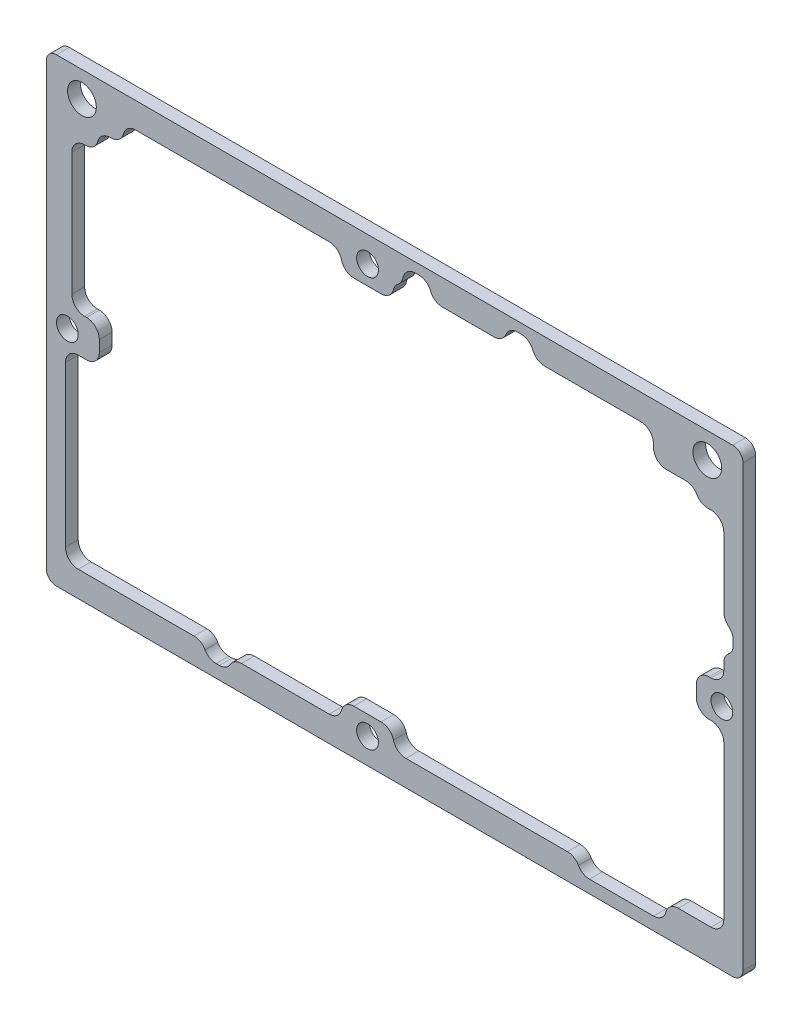
from build123d import *

# Parameters (mm, degrees)
SKETCH1_W                  = 173.0375
SKETCH1_H                  = 114.3
BOSS_EXTRUDE1_DEPTH        = 3.175
SKETCH3_R                  = 3.175
SKETCH3_R_2                = 3.7703125
CUT_EXTRUDE1_DEPTH         = 149.360729792
F_6_CLEARANCE_HOLE1_D      = 4.3053
F_3_0_213_DIAMETER_HOLE1_D = 5.4102
F_1_4_CLEARANCE_HOLE1_D    = 7.14248
CUT_EXTRUDE5_REACH         = 150.361
SKETCH16_R                 = 1.190625
CUT_EXTRUDE6_DEPTH         = 149.360729792
FILLET5_R                  = 3.175
FILLET6_R                  = 3.175
FILLET7_R                  = 2.54


with BuildPart() as part:
    # Sketch1 → Boss-Extrude1 (new body)
    with BuildSketch(Plane.XY):
        with Locations((25.118, -40.513)):
            Rectangle(SKETCH1_W, SKETCH1_H)
    extrude(amount=BOSS_EXTRUDE1_DEPTH)

    # Sketch3 → Cut-Extrude1 (cut, through all)
    with BuildSketch(Plane.XY.offset(3.175)):
        with Locations((100.302, -26.543)):
            Circle(SKETCH3_R)
        with Locations((99.413, -51.6255)):
            Circle(SKETCH3_R_2)
        with Locations((-47.907, -51.6255)):
            Circle(SKETCH3_R_2)
        with Locations((-47.907, -6.5405)):
            Circle(SKETCH3_R_2)
    extrude(amount=-CUT_EXTRUDE1_DEPTH, mode=Mode.SUBTRACT)

    # #6 Clearance Hole1 (through all)
    with Locations(Plane.XY.offset(3.175)):
        with Locations((18.387, 10.287), (-56.162, -40.894), (106.398, -40.894), (18.387, -91.313)):
            Hole(F_6_CLEARANCE_HOLE1_D / 2)

    # #3 (0.213) Diameter Hole1 (through all)
    with Locations(Plane(origin=(18.387, 10.287, 3.175), x_dir=(1, 0, 0), z_dir=(0, 0, 1))):
        with Locations((0, 0), (-74.549, -51.181), (0, -101.6), (88.011, -51.181)):
            Hole(F_3_0_213_DIAMETER_HOLE1_D / 2)

    # 1/4 Clearance Hole1 (through all)
    with Locations(Plane(origin=(0, 0, 0), x_dir=(-1, 0, 0), z_dir=(0, 0, -1))):
        with Locations((-102.7785, 10.287), (52.5425, 10.287)):
            Hole(F_1_4_CLEARANCE_HOLE1_D / 2)

    # Sketch16 → Cut-Extrude5 (cut, up to next)
    with BuildSketch(Plane(origin=(0, 0, 0), x_dir=(-1, 0, 0), z_dir=(0, 0, -1)), mode=Mode.PRIVATE) as cut_extrude5_sk1:
        with Locations((-98.142490655, -57.489441166)):
            Circle(SKETCH16_R)
    cut_extrude5_tool1 = extrude(cut_extrude5_sk1.sketch, amount=-CUT_EXTRUDE5_REACH, mode=Mode.PRIVATE) & part.part
    # Sketch16 → Cut-Extrude5 (cut, up to next)
    with BuildSketch(Plane(origin=(0, 0, 0), x_dir=(-1, 0, 0), z_dir=(0, 0, -1)), mode=Mode.PRIVATE) as cut_extrude5_sk2:
        with Locations((49.177509345, -57.489441166)):
            Circle(SKETCH16_R)
    cut_extrude5_tool2 = extrude(cut_extrude5_sk2.sketch, amount=-CUT_EXTRUDE5_REACH, mode=Mode.PRIVATE) & part.part
    # Sketch16 → Cut-Extrude5 (cut, up to next)
    with BuildSketch(Plane(origin=(0, 0, 0), x_dir=(-1, 0, 0), z_dir=(0, 0, -1)), mode=Mode.PRIVATE) as cut_extrude5_sk3:
        with Locations((49.177509345, -12.404441166)):
            Circle(SKETCH16_R)
    cut_extrude5_tool3 = extrude(cut_extrude5_sk3.sketch, amount=-CUT_EXTRUDE5_REACH, mode=Mode.PRIVATE) & part.part
    add(cut_extrude5_tool1.solids().sort_by_distance((98.142491, -57.489441, 0))[0], mode=Mode.SUBTRACT)
    add(cut_extrude5_tool2.solids().sort_by_distance((-49.177509, -57.489441, 0))[0], mode=Mode.SUBTRACT)
    add(cut_extrude5_tool3.solids().sort_by_distance((-49.177509, -12.404441, 0))[0], mode=Mode.SUBTRACT)

    # Sketch17 → Cut-Extrude6 (cut, through all)
    with BuildSketch(Plane(origin=(0, 0, 0), x_dir=(-1, 0, 0), z_dir=(0, 0, -1))):
        Polygon((-89.41175, 10.287), (-59.68051, 10.287), (-59.68051, 14.25702), (-52.53549, 14.25702), (-52.53549, 10.287), (-34.28051, 10.287), (-34.28051, 14.25702), (-27.13549, 14.25702), (-27.13549, 10.287), (-24.737, 10.287), (-24.737, 5.5245), (-12.037, 5.5245), (-12.037, 10.287), (42.35075, 10.287), (42.35075, 5.5245), (48.70075, 5.5245), (48.70075, 0.762), (55.05075, 0.762), (55.05075, -36.1315), (48.2245, -36.1315), (48.2245, -45.26026), (56.63825, -45.26026), (56.63825, -91.313), (22.39451, -91.313), (22.39451, -94.488), (15.24949, -94.488), (15.24949, -91.313), (-12.037, -91.313), (-12.037, -86.5505), (-24.737, -86.5505), (-24.737, -91.313), (-70.36175, -91.313), (-70.36175, -94.488), (-92.58675, -94.488), (-92.58675, -89.7255), (-106.87425, -89.7255), (-106.87425, -45.26026), (-100.048, -45.26026), (-100.048, -36.1315), (-106.87425, -36.1315), (-106.87425, -28.194), (-109.22375, -28.194), (-109.22375, -23.4315), (-106.87425, -23.4315), (-106.87425, 0), (-99.72923, 0), (-99.72923, 3.175), (-89.41175, 3.175), align=None)
    extrude(amount=-CUT_EXTRUDE6_DEPTH, mode=Mode.SUBTRACT)

    # Fillet5
    # the kernel refuses this fillet: 3.175 mm, written as the material it adds along each edge
    with BuildSketch(Plane(origin=(106.87425, 0, 0), x_dir=(0, -1, 0), z_dir=(0, 0, 1)), Plane(origin=(106.87425, -45.26026, 0), x_dir=(0, -1, 0), z_dir=(0, 0, 1)), Plane(origin=(106.87425, -36.1315, 0), x_dir=(-1, 0, 0), z_dir=(0, 0, 1)), Plane(origin=(106.87425, -89.7255, 0), x_dir=(-1, 0, 0), z_dir=(0, 0, 1)), Plane(origin=(92.58675, -94.488, 0), x_dir=(-1, 0, 0), z_dir=(0, 0, 1)), Plane(origin=(70.36175, -94.488, 0), x_dir=(0, 1, 0), z_dir=(0, 0, 1)), Plane(origin=(24.737, -91.313, 0), x_dir=(0, 1, 0), z_dir=(0, 0, 1)), Plane(origin=(12.037, -91.313, 0), x_dir=(-1, 0, 0), z_dir=(0, 0, 1)), Plane(origin=(-15.24949, -94.488, 0), x_dir=(-1, 0, 0), z_dir=(0, 0, 1)), Plane(origin=(-22.39451, -94.488, 0), x_dir=(0, 1, 0), z_dir=(0, 0, 1)), Plane(origin=(-56.63825, -91.313, 0), x_dir=(0, 1, 0), z_dir=(0, 0, 1)), Plane(origin=(-55.05075, -36.1315, 0), x_dir=(0, 1, 0), z_dir=(0, 0, 1)), Plane(origin=(-56.63825, -45.26026, 0), x_dir=(1, 0, 0), z_dir=(0, 0, 1)), Plane(origin=(-55.05075, 0.762, 0), x_dir=(1, 0, 0), z_dir=(0, 0, 1)), Plane(origin=(-48.70075, 5.5245, 0), x_dir=(1, 0, 0), z_dir=(0, 0, 1)), Plane(origin=(-42.35075, 10.287, 0), x_dir=(1, 0, 0), z_dir=(0, 0, 1)), Plane(origin=(12.037, 10.287, 0), x_dir=(0, -1, 0), z_dir=(0, 0, 1)), Plane(origin=(34.28051, 14.25702, 0), x_dir=(0, -1, 0), z_dir=(0, 0, 1)), Plane(origin=(27.13549, 14.25702, 0), x_dir=(1, 0, 0), z_dir=(0, 0, 1)), Plane(origin=(52.53549, 14.25702, 0), x_dir=(1, 0, 0), z_dir=(0, 0, 1)), Plane(origin=(59.68051, 14.25702, 0), x_dir=(0, -1, 0), z_dir=(0, 0, 1))) as fillet5_piece_1:
        with BuildLine():
            CenterArc((FILLET5_R, -FILLET5_R), FILLET5_R, 90, 90)
            Line((0, -FILLET5_R), (-FILLET5_R * 0.02, -FILLET5_R))
            Line((-FILLET5_R * 0.02, -FILLET5_R), (-FILLET5_R * 0.02, FILLET5_R * 0.02))
            Line((-FILLET5_R * 0.02, FILLET5_R * 0.02), (FILLET5_R, FILLET5_R * 0.02))
            Line((FILLET5_R, FILLET5_R * 0.02), (FILLET5_R, 0))
        make_face()
    extrude(amount=3.175)
    with BuildSketch(Plane(origin=(24.737, 10.287, 0), x_dir=(1, 0, 0), z_dir=(0, 0, 1))) as fillet5_piece_2:
        with BuildLine():
            CenterArc((3.175, -3.07858039), FILLET5_R, 104.15642815, 75.84357185)
            Line((0, -3.07858039), (-0.0635, -3.07858039))
            Line((-0.0635, -3.07858039), (-0.0635, 0))
            Line((-0.0635, 0), (0, 0.0635))
            ThreePointArc((0, 0.0635), (1.199245, 0.0635), (2.3829598, 0.061571608))
            Line((2.3829598, 0.061571608), (2.39849, 0))
        make_face()
    extrude(amount=3.175)
    with BuildSketch(Plane(origin=(89.41175, 10.287, 0), x_dir=(-1, 0, 0), z_dir=(0, 0, 1))) as fillet5_piece_3:
        with BuildLine():
            CenterArc((FILLET5_R, FILLET5_R), FILLET5_R, 180, 90)
            Line((0, FILLET5_R), (-FILLET5_R * 0.02, FILLET5_R))
            Line((-FILLET5_R * 0.02, FILLET5_R), (-FILLET5_R * 0.02, -FILLET5_R * 0.02))
            Line((-FILLET5_R * 0.02, -FILLET5_R * 0.02), (FILLET5_R, -FILLET5_R * 0.02))
            Line((FILLET5_R, -FILLET5_R * 0.02), (FILLET5_R, 0))
        make_face()
    extrude(amount=3.175)
    # the kernel refuses this fillet: 3.175 mm, written as the material it takes off along each edge
    with BuildSketch(Plane(origin=(99.72923, 0, -7.9375), x_dir=(1, 0, 0), z_dir=(0, 0, 1)), Plane(origin=(89.41175, 3.175, -7.9375), x_dir=(1, 0, 0), z_dir=(0, 0, 1))) as fillet5_2_piece_1:
        with BuildLine():
            CenterArc((FILLET5_R, FILLET5_R), FILLET5_R, 180, 90)
            Line((0, FILLET5_R), (-FILLET5_R * 0.02, FILLET5_R))
            Line((-FILLET5_R * 0.02, FILLET5_R), (-FILLET5_R * 0.02, -FILLET5_R * 0.02))
            Line((-FILLET5_R * 0.02, -FILLET5_R * 0.02), (FILLET5_R, -FILLET5_R * 0.02))
            Line((FILLET5_R, -FILLET5_R * 0.02), (FILLET5_R, 0))
        make_face()
    extrude(amount=19.05, mode=Mode.SUBTRACT)
    with BuildSketch(Plane(origin=(106.87425, -23.4315, -7.664518392), x_dir=(1, 0, 0), z_dir=(0, 0, 1))) as fillet5_2_piece_2:
        with BuildLine():
            CenterArc((3.175, 3.065807357), FILLET5_R, 180, 74.929937855)
            Line((0, 3.065807357), (-0.0635, 3.065807357))
            Line((-0.0635, 3.065807357), (-0.0635, 0))
            Line((-0.0635, 0), (0, -0.0635))
            ThreePointArc((0, -0.0635), (1.17475, -0.0635), (2.33299, -0.061316147))
            Line((2.33299, -0.061316147), (2.3495, 0))
        make_face()
    extrude(amount=18.504036785, mode=Mode.SUBTRACT)
    with BuildSketch(Plane(origin=(106.87425, -28.194, -7.664518392), x_dir=(0, -1, 0), z_dir=(0, 0, 1))) as fillet5_2_piece_3:
        with BuildLine():
            CenterArc((3.065807357, 3.175), FILLET5_R, 195.070062145, 74.929937855)
            Line((0, 2.3495), (-0.061316147, 2.33299))
            ThreePointArc((-0.061316147, 2.33299), (-0.0635, 1.17475), (-0.0635, 0))
            Line((-0.0635, 0), (0, -0.0635))
            Line((0, -0.0635), (3.065807357, -0.0635))
            Line((3.065807357, -0.0635), (3.065807357, 0))
        make_face()
    extrude(amount=18.504036785, mode=Mode.SUBTRACT)

    # Fillet6
    fillet6_edges = [part.edges().sort_by_distance(p)[0] for p in [
        (99.72923, 3.175, 1.5875),
        (59.68051, 10.287, 1.5875),
        (52.53549, 10.287, 1.5875),
        (34.28051, 10.287, 1.5875),
        (27.13549, 10.287, 1.5875),
        (24.737, 5.5245, 1.5875),
        (12.037, 5.5245, 1.5875),
        (-42.35075, 5.5245, 1.5875),
        (-48.70075, 0.762, 1.5875),
        (-48.2245, -36.1315, 1.5875),
        (-48.2245, -45.26026, 1.5875),
        (-22.39451, -91.313, 1.5875),
        (-15.24949, -91.313, 1.5875),
        (12.037, -86.5505, 1.5875),
        (24.737, -86.5505, 1.5875),
        (70.36175, -91.313, 1.5875),
        (92.58675, -89.7255, 1.5875),
        (100.048, -45.26026, 1.5875),
        (100.048, -36.1315, 1.5875),
        (109.22375, -28.194, 1.5875),
        (109.22375, -23.4315, 1.5875),
    ]]
    fillet(fillet6_edges, radius=FILLET6_R)

    # Fillet7
    fillet7_edges = [part.edges().sort_by_distance(p)[0] for p in [
        (-61.40075, 16.637, 1.5875),
        (111.63675, 16.637, 1.5875),
        (111.63675, -97.663, 1.5875),
        (-61.40075, -97.663, 1.5875),
    ]]
    fillet(fillet7_edges, radius=FILLET7_R)


solid = part.part
